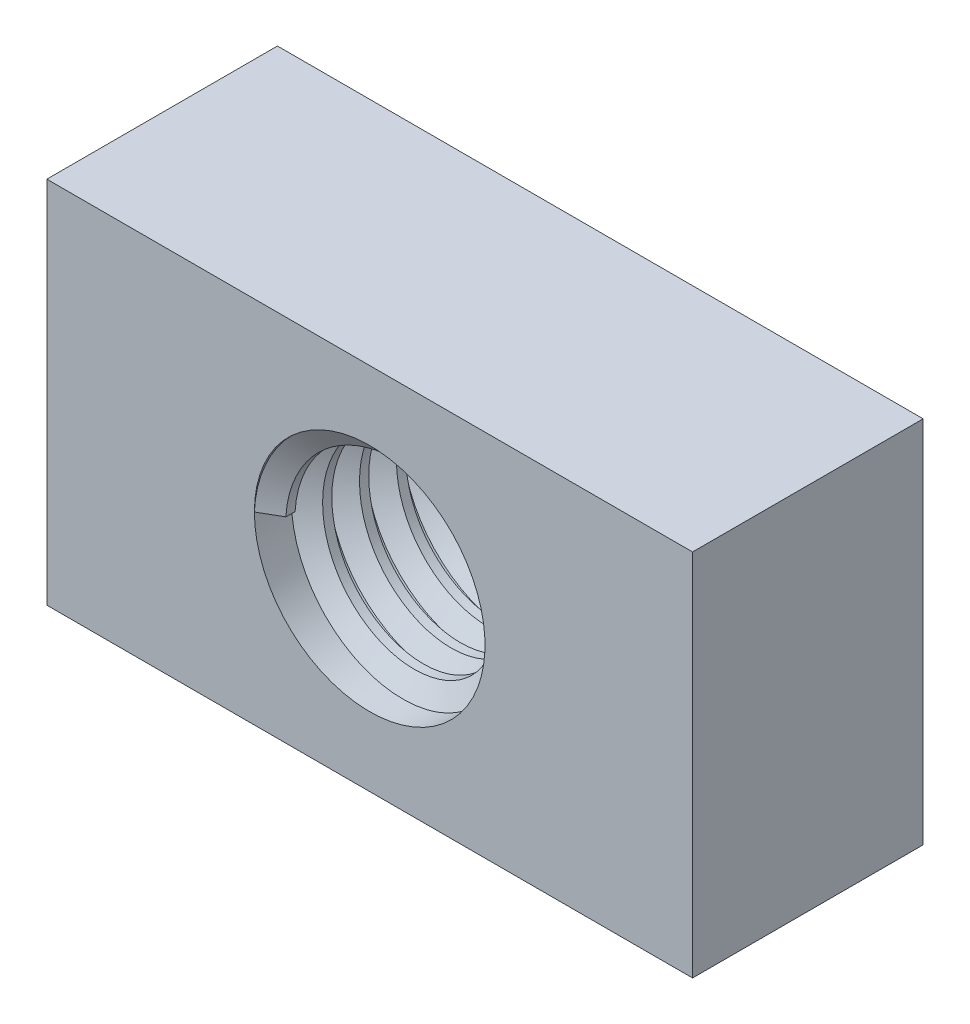
from build123d import *

# Parameters (mm, degrees)
SKETCH1_W           = 14
SKETCH1_H           = 8
SKETCH1_R           = 2.5
BOSS_EXTRUDE1_DEPTH = 5
THREAD1_PITCH       = 0.8


with BuildPart() as part:
    # Sketch1 → Boss-Extrude1 (new body)
    with BuildSketch(Plane.XY):
        with Locations((7, 4)):
            Rectangle(SKETCH1_W, SKETCH1_H)
        with Locations((7, 4)):
            Circle(SKETCH1_R, mode=Mode.SUBTRACT)
    extrude(amount=BOSS_EXTRUDE1_DEPTH)

    # Thread1: the profile of Thread Profile1 profile screwed along a right-hand helix of 5.625 turns, 8 arcs to a turn; built about Z, then put on its axis
    thread1_z = Axis((0, 0, 0), (0, 0, 1))
    thread1_corners = [(2.5003, 0, -0.000173205), (2.5003, 0, 0.700173203), (2.0669873, 0, 0.449999999), (2.0669873, 0, 0.249999999)]
    with BuildLine(mode=Mode.PRIVATE) as thread1_profile:
        Line(thread1_corners[0], thread1_corners[1])
        Line(thread1_corners[1], thread1_corners[2])
        Line(thread1_corners[2], thread1_corners[3])
        Line(thread1_corners[3], thread1_corners[0])
    thread1_cap = Face(thread1_profile.wire())
    thread1_turn_angles = [0, 22.5, 45, 67.5, 90, 112.5, 135, 157.5, 180, 202.5, 225, 247.5, 270, 292.5, 315, 337.5, 360]
    thread1_turn_weights = [1, 0.9238795325112867, 1, 0.9238795325112867, 1, 0.9238795325112867, 1, 0.9238795325112867, 1, 0.9238795325112867, 1, 0.9238795325112867, 1, 0.9238795325112867, 1, 0.9238795325112867, 1]
    thread1_turn_rails = [Edge.make_bspline([Vector(p[0], p[1], 0).rotate(thread1_z, thread1_turn_angles[k]) / thread1_turn_weights[k] + Vector(0, 0, p[2] + THREAD1_PITCH * thread1_turn_angles[k] / 360) for k in range(17)], [0, 0, 0, 1, 1, 2, 2, 3, 3, 4, 4, 5, 5, 6, 6, 7, 7, 8, 8, 8], 2, thread1_turn_weights) for p in thread1_corners]
    thread1_turn_sides = [Face.make_surface_from_curves(thread1_turn_rails[p[0]], thread1_turn_rails[p[1]]) for p in [(0, 1), (1, 2), (2, 3), (3, 0)]]
    thread1_last_angles = [1800, 1822.5, 1845, 1867.5, 1890, 1912.5, 1935, 1957.5, 1980, 2002.5, 2025]
    thread1_last_weights = [1, 0.9238795325112867, 1, 0.9238795325112867, 1, 0.9238795325112867, 1, 0.9238795325112867, 1, 0.9238795325112867, 1]
    thread1_last_rails = [Edge.make_bspline([Vector(p[0], p[1], 0).rotate(thread1_z, thread1_last_angles[k]) / thread1_last_weights[k] + Vector(0, 0, p[2] + THREAD1_PITCH * thread1_last_angles[k] / 360) for k in range(11)], [0, 0, 0, 1, 1, 2, 2, 3, 3, 4, 4, 5, 5, 5], 2, thread1_last_weights) for p in thread1_corners]
    thread1_last_sides = [Face.make_surface_from_curves(thread1_last_rails[p[0]], thread1_last_rails[p[1]]) for p in [(0, 1), (1, 2), (2, 3), (3, 0)]]
    thread1 = Plane(origin=(7, 4, 5), x_dir=(-1, 0, 0), z_dir=(0, 0, -1)) * Solid(Shell([*[p.moved(Location((0, 0, THREAD1_PITCH * i))) for i in range(5) for p in thread1_turn_sides], *thread1_last_sides, thread1_cap, thread1_cap.rotate(thread1_z, 2025).moved(Location((0, 0, THREAD1_PITCH * 2025 / 360)))]))
    add(thread1)


solid = part.part
